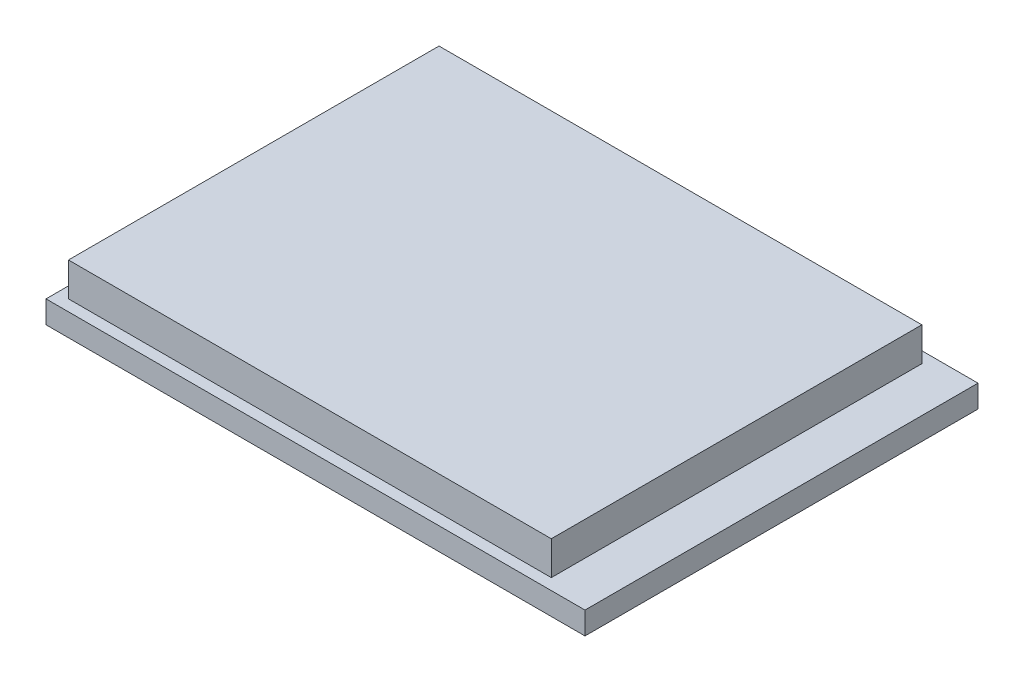
from build123d import *

# Parameters (mm, degrees)
SKETCH1_W           = 48
SKETCH1_H           = 35
BOSS_EXTRUDE1_DEPTH = 2
SKETCH2_W           = 43
SKETCH2_H           = 33
BOSS_EXTRUDE2_DEPTH = 3
SKETCH3_W           = 5.491242003
SKETCH3_H           = 3
BOSS_EXTRUDE3_DEPTH = 5
SKETCH4_R           = 1
CUT_EXTRUDE1_DEPTH  = 53.239831546


with BuildPart() as part:
    # Sketch1 → Boss-Extrude1 (new body)
    with BuildSketch(Plane(origin=(0, 0, 0), x_dir=(1, 0, 0), z_dir=(0, 1, 0))):
        with Locations((24, -17.5)):
            Rectangle(SKETCH1_W, SKETCH1_H)
    extrude(amount=BOSS_EXTRUDE1_DEPTH)

    # Sketch2 → Boss-Extrude2 (add)
    with BuildSketch(Plane(origin=(0, 2, 0), x_dir=(1, 0, 0), z_dir=(0, 1, 0))):
        with Locations((22.5, -17.5)):
            Rectangle(SKETCH2_W, SKETCH2_H)
    extrude(amount=BOSS_EXTRUDE2_DEPTH)

    # Sketch3 → Boss-Extrude3 (add)
    with BuildSketch(Plane.XZ):
        with Locations((27.834801154, 18.5)):
            Rectangle(SKETCH3_W, SKETCH3_H)
    extrude(amount=BOSS_EXTRUDE3_DEPTH)

    # Sketch4 → Cut-Extrude1 (cut, through all)
    with BuildSketch(Plane.XY.offset(20)):
        with Locations((27.560182347, -2.619839314)):
            Circle(SKETCH4_R)
    extrude(amount=-CUT_EXTRUDE1_DEPTH, mode=Mode.SUBTRACT)


solid = part.part
